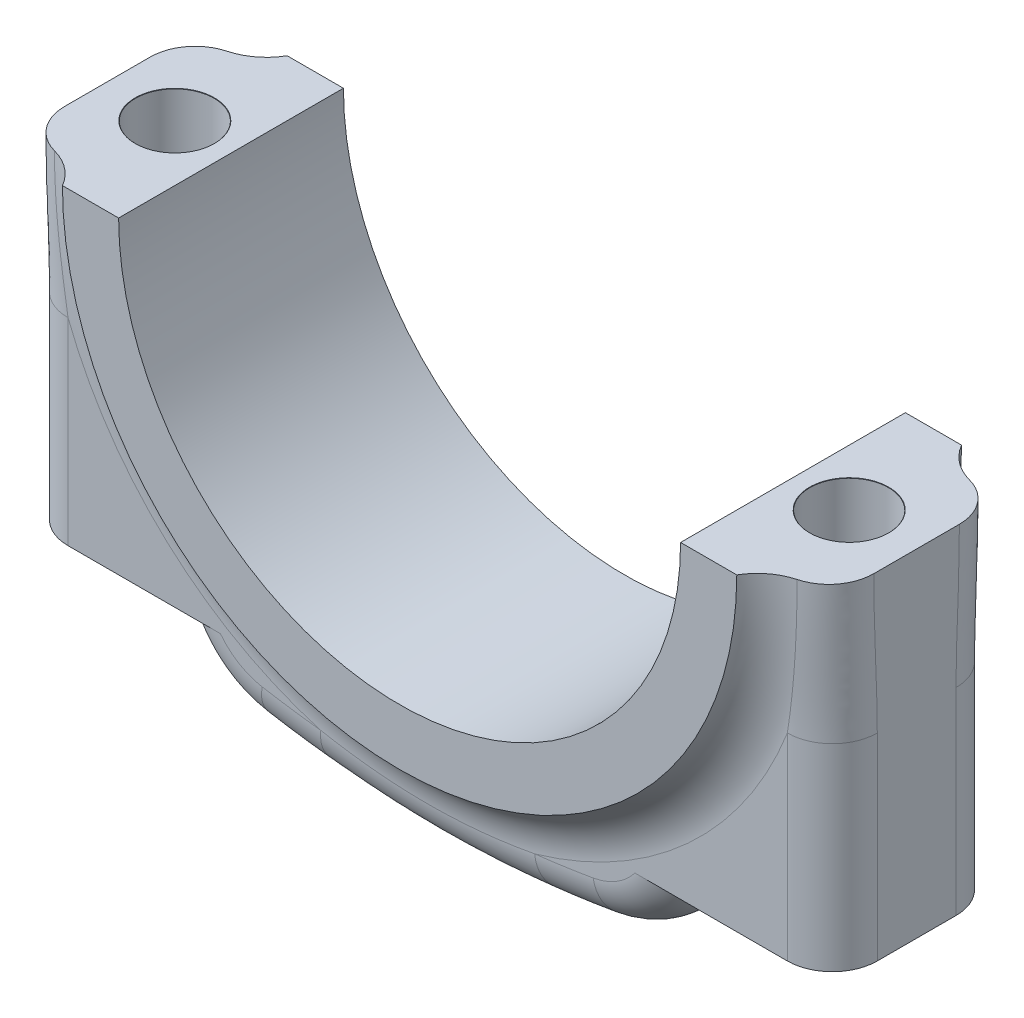
from build123d import *

# Parameters (mm, degrees)
BOSS_EXTRUDE1_DEPTH                = 7.5
BOSS_EXTRUDE2_START                = 2.5
BOSS_EXTRUDE2_DEPTH                = 2.5
BOSS_EXTRUDE3_DEPTH                = 2.5
FILLET1_R                          = 5
F_7_0_7_DIAMETER_HOLE5_D           = 7
F_7_0_7_DIAMETER_HOLE5_CSINK_D     = 7.05
F_7_0_7_DIAMETER_HOLE5_CSINK_ANGLE = 90
SKETCH6_W                          = 20.539151738
SKETCH6_H                          = 29.388035294
CUT_EXTRUDE1_DEPTH                 = 48.916594278
FILLET2_R                          = 10
FILLET3_R                          = 4


with BuildPart() as part:
    # Sketch1 → Boss-Extrude1 (new, symmetric)
    with BuildSketch(Plane.XY):
        with BuildLine():
            Line((-36, 0), (-25, 0))
            ThreePointArc((-25, 0), (0, -25), (25, 0))
            Line((25, 0), (36, 0))
            Line((36, 0), (36, -30))
            ThreePointArc((36, -30), (0, -37.513637491), (-36, -30))
            Line((-36, -30), (-36, 0))
        make_face()
    extrude(amount=BOSS_EXTRUDE1_DEPTH, both=True)

    # Sketch2 → Boss-Extrude2 (add)
    with BuildSketch(Plane.XY.offset(7.5).offset(BOSS_EXTRUDE2_START)):
        with BuildLine():
            Line((-30, 0), (-25, 0))
            ThreePointArc((-25, 0), (0, -25), (25, 0))
            Line((25, 0), (30, 0))
            ThreePointArc((30, 0), (0, -30), (-30, 0))
        make_face()
    extrude(amount=-BOSS_EXTRUDE2_DEPTH)

    # Sketch3 → Boss-Extrude3 (add)
    with BuildSketch(Plane(origin=(0, 0, -7.5), x_dir=(-1, 0, 0), z_dir=(0, 0, -1))):
        with BuildLine():
            Line((30, 0), (25, 0))
            ThreePointArc((25, 0), (0, -25), (-25, 0))
            Line((-25, 0), (-30, 0))
            ThreePointArc((-30, 0), (0, -30), (30, 0))
        make_face()
    extrude(amount=BOSS_EXTRUDE3_DEPTH)

    # Fillet1
    # the kernel refuses this fillet: 5 mm, written as the material it adds along each edge
    with BuildSketch(Plane(origin=(0, 0, -7.5), x_dir=(1, 0, 0), z_dir=(0, 1, 0))) as fillet1_piece_1:
        with BuildLine():
            CenterArc((34.330127019, 5), FILLET1_R, 210, 60)
            Line((34.330127019, 0), (34.330127019, -0.1))
            Line((34.330127019, -0.1), (30, -0.1))
            Line((30, -0.1), (29.9, 0))
            ThreePointArc((29.9, 0), (29.9, 1.25), (29.91339746, 2.45))
            Line((29.91339746, 2.45), (30, 2.5))
        make_face()
    revolve(axis=Axis((0, 0, -7.5), (0, 0, -1)), revolution_arc=180)
    with BuildSketch(Plane(origin=(0, 0, 7.5), x_dir=(1, 0, 0), z_dir=(0, 1, 0))) as fillet1_piece_2:
        with BuildLine():
            CenterArc((34.330127019, -5), FILLET1_R, 90, 60)
            Line((30, -2.5), (29.91339746, -2.45))
            ThreePointArc((29.91339746, -2.45), (29.9, -1.25), (29.9, 0))
            Line((29.9, 0), (30, 0.1))
            Line((30, 0.1), (34.330127019, 0.1))
            Line((34.330127019, 0.1), (34.330127019, 0))
        make_face()
    revolve(axis=Axis((0, 0, 7.5), (0, 0, -1)), revolution_arc=180)

    # Ø7.0 (7) Diameter Hole5 (through all)
    with Locations(Plane(origin=(0, 0, 0), x_dir=(1, 0, 0), z_dir=(0, 1, 0))):
        with Locations((30, 0), (-30, 0)):
            CounterSinkHole(F_7_0_7_DIAMETER_HOLE5_D / 2, F_7_0_7_DIAMETER_HOLE5_CSINK_D / 2, counter_sink_angle=F_7_0_7_DIAMETER_HOLE5_CSINK_ANGLE)

    # Sketch6 → Cut-Extrude1 (cut, through all)
    with BuildSketch(Plane(origin=(0, -30, 0), x_dir=(1, 0, 0), z_dir=(0, 1, 0))):
        with Locations((33.269575869, 1.461283523)):
            Rectangle(SKETCH6_W, SKETCH6_H)
        with Locations((-33.269575869, 1.461283523)):
            Rectangle(SKETCH6_W, SKETCH6_H)
    extrude(amount=-CUT_EXTRUDE1_DEPTH, mode=Mode.SUBTRACT)

    # Fillet2
    # the kernel refuses this fillet: 10 mm, written as the material it takes off along each edge
    with BuildSketch(Plane(origin=(-23, -34.525130984, -26.925869483), x_dir=(0, 1, 0), z_dir=(0, 0, 1))) as fillet2_piece_1:
        with BuildLine():
            CenterArc((8.192736848, -9.303153617), FILLET2_R, 111.515972429, 58.625815396)
            Line((-1.659607733, -7.59104782), (-1.856654624, -7.556805704))
            ThreePointArc((-1.856654624, -7.556805704), (-1.107150814, -3.734888389), (-0.193358874, 0.051111111))
            Line((-0.193358874, 0.051111111), (0, 0.2))
            ThreePointArc((0, 0.2), (2.262565492, 0.2), (4.451778867, 0.186063072))
            Line((4.451778867, 0.186063072), (4.525130984, 0))
        make_face()
    extrude(amount=53.851738966, mode=Mode.SUBTRACT)
    with BuildSketch(Plane(origin=(23, -34.525130984, -26.925869483), x_dir=(-0.9769251031886325, -0.21358216863745888, 0), z_dir=(0, 0, 1))) as fillet2_piece_2:
        with BuildLine():
            CenterArc((7.338661805, -9.990678015), FILLET2_R, 87.525852632, 58.625815396)
            Line((-0.966487289, -4.420714054), (-1.132590271, -4.309314775))
            ThreePointArc((-1.132590271, -4.309314775), (-0.678628665, -2.167640593), (-0.195385021, 0.042716434))
            Line((-0.195385021, 0.042716434), (-0.00863372, 0.19981356))
            ThreePointArc((-0.00863372, 0.19981356), (3.885173897, 0.283897861), (7.778981513, 0.19981356))
            Line((7.778981513, 0.19981356), (7.770347793, 0))
        make_face()
    extrude(amount=53.851738966, mode=Mode.SUBTRACT)

    # Fillet3
    fillet3_edges = [part.edges().sort_by_distance(p)[0] for p in [
        (-20.013232473, -34.085023803, 7.5),
        (0, -37.513637491, 7.5),
        (20.013232473, -34.085023803, -7.5),
        (0, -37.513637491, -7.5),
        (-36, -15, 7.5),
        (-36, -15, -7.5),
        (36, -15, -7.5),
        (36, -15, 7.5),
        (20.013232473, -34.085023803, 7.5),
        (-20.013232473, -34.085023803, -7.5),
    ]]
    fillet(fillet3_edges, radius=FILLET3_R)


solid = part.part
